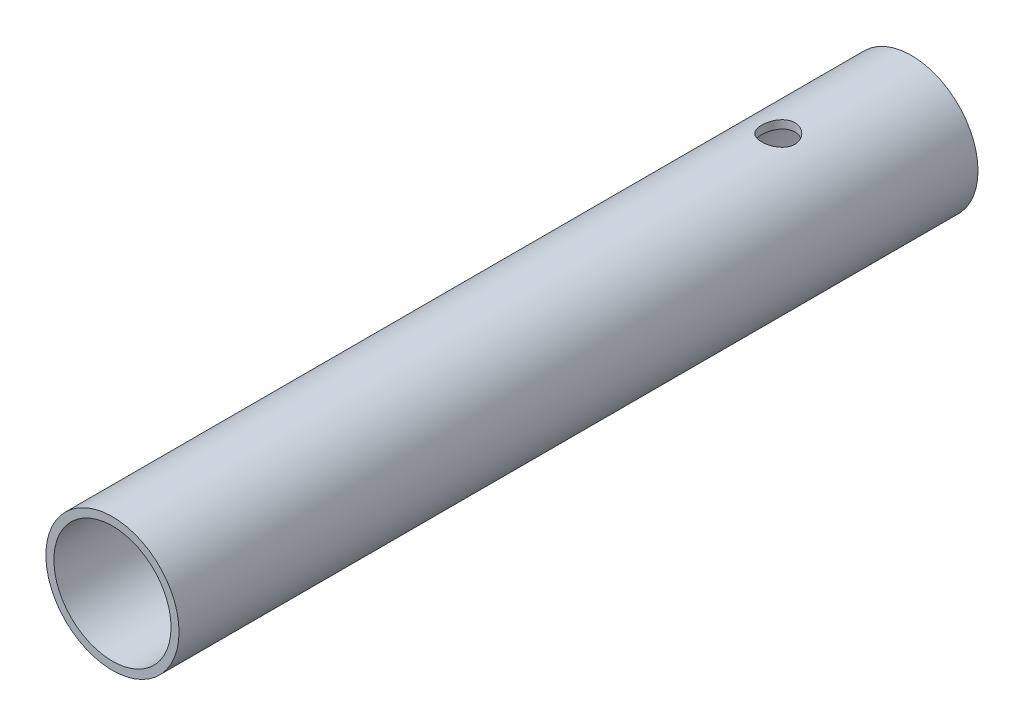
from build123d import *

# Parameters (mm, degrees)
SKETCH3_R           = 25.4
SKETCH3_R_2         = 22.352
BOSS_EXTRUDE1_DEPTH = 152.4
SKETCH4_R           = 6.35
CUT_EXTRUDE1_DEPTH  = 163.639355631


with BuildPart() as part:
    # Sketch3 → Boss-Extrude1 (new, symmetric)
    with BuildSketch(Plane.XY):
        Circle(SKETCH3_R)
        Circle(SKETCH3_R_2, mode=Mode.SUBTRACT)
    extrude(amount=BOSS_EXTRUDE1_DEPTH, both=True)

    # Sketch4 → Cut-Extrude1 (cut, through all)
    with BuildSketch(Plane(origin=(0, 25.4, 0), x_dir=(1, 0, 0), z_dir=(0, 1, 0))):
        with Locations((0, 101.6)):
            Circle(SKETCH4_R)
    extrude(amount=-CUT_EXTRUDE1_DEPTH, mode=Mode.SUBTRACT)


solid = part.part
